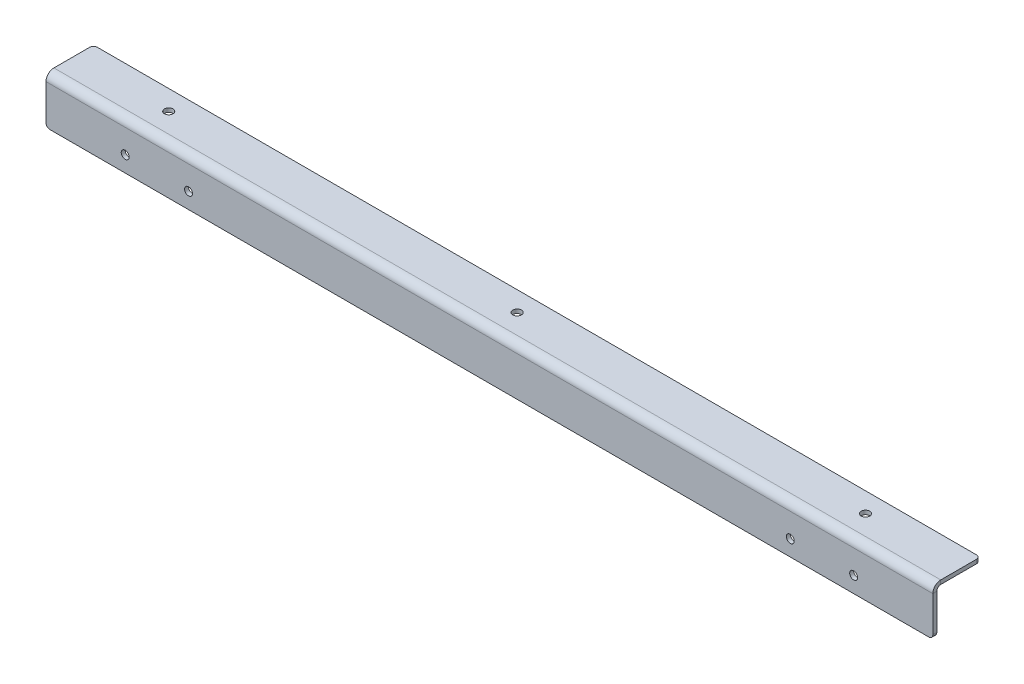
from build123d import *

# Parameters (mm, degrees)
BASE_FLANGE1_DEPTH = 711.2
SKETCH18_R         = 3.429
CUT_EXTRUDE1_DEPTH = 3.175
FILLET1_R          = 3.175
SKETCH20_R         = 3.175
CUT_EXTRUDE2_DEPTH = 3.175


# Sheet-metal steps are written as plain solids
with BuildPart() as part:
    # Sketch1 → Base-Flange1 (new body)
    with BuildSketch(Plane(origin=(0, 0, 0), x_dir=(0, 0, -1), z_dir=(1, 0, 0))):
        with BuildLine():
            Line((0, 0), (0, 31.75))
            ThreePointArc((0, 31.75), (1.859871939, 36.240128061), (6.35, 38.1))
            Line((6.35, 38.1), (38.1, 38.1))
            Line((38.1, 38.1), (38.1, 34.925))
            Line((38.1, 34.925), (6.35, 34.925))
            ThreePointArc((6.35, 34.925), (4.10493597, 33.99506403), (3.175, 31.75))
            Line((3.175, 31.75), (3.175, 0))
            Line((3.175, 0), (0, 0))
        make_face()
    extrude(amount=BASE_FLANGE1_DEPTH)

    # Sketch18 → Cut-Extrude1 (cut)
    with BuildSketch(Plane(origin=(0, 38.1, 0), x_dir=(1, 0, 0), z_dir=(0, 1, 0))):
        with Locations(Location((76.2, 22.225, 0), (0, 0, 270))):
            Circle(SKETCH18_R)
        with Locations(Location((355.6, 22.225, 0), (0, 0, 270))):
            Circle(SKETCH18_R)
        with Locations(Location((635, 22.225, 0), (0, 0, 270))):
            Circle(SKETCH18_R)
    extrude(amount=-CUT_EXTRUDE1_DEPTH, mode=Mode.SUBTRACT)

    # Fillet1
    fillet1_edges = [part.edges().sort_by_distance(p)[0] for p in [
        (711.2, 0, -1.5875),
        (0, 0, -1.5875),
        (711.2, 36.5125, -38.1),
        (0, 36.5125, -38.1),
    ]]
    fillet(fillet1_edges, radius=FILLET1_R)

    # Sketch20 → Cut-Extrude2 (cut)
    with BuildSketch(Plane.XY):
        with Locations((63.5, 12.7)):
            Circle(SKETCH20_R)
        with Locations((114.3, 12.7)):
            Circle(SKETCH20_R)
        with Locations((596.9, 12.7)):
            Circle(SKETCH20_R)
        with Locations((647.7, 12.7)):
            Circle(SKETCH20_R)
    extrude(amount=-CUT_EXTRUDE2_DEPTH, mode=Mode.SUBTRACT)


solid = part.part
